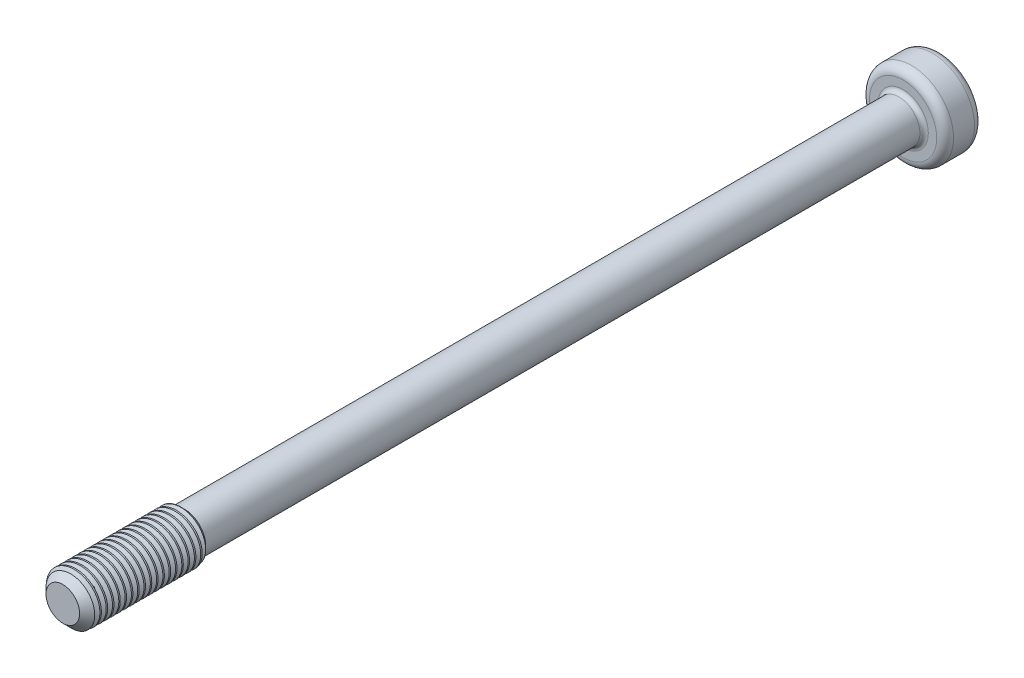
from build123d import *

# Parameters (mm, degrees)
SKETCH1_R           = 1
BOSS_EXTRUDE1_DEPTH = 0.9
SKETCH2_R           = 0.5
BOSS_EXTRUDE2_DEPTH = 20
CUT_EXTRUDE5_DEPTH  = 0.15
CIRPATTERN2_COUNT   = 4
FILLET2_R           = 0.1
FILLET3_R           = 0.2
SKETCH10_R          = 0.6
BOSS_EXTRUDE3_DEPTH = 3
CHAMFER1_SIZE       = 0.2
CUT_SWEEP1_PITCH    = 0.15


with BuildPart() as part:
    # Sketch1 → Boss-Extrude1 (new body)
    with BuildSketch(Plane.XY):
        Circle(SKETCH1_R)
    extrude(amount=BOSS_EXTRUDE1_DEPTH)

    # Sketch2 → Boss-Extrude2 (add)
    with BuildSketch(Plane.XY.offset(0.9)):
        Circle(SKETCH2_R)
    extrude(amount=BOSS_EXTRUDE2_DEPTH)

    # Sketch4 → Cut-Extrude5 (cut, symmetric)
    with BuildSketch(Plane(origin=(0, 0, 0), x_dir=(1, 0, 0), z_dir=(0, 1, 0))):
        Polygon((-0.608938415, -0.8), (0, -0.8), (0, 0), (-0.75, 0), align=None)
    cut_extrude5 = extrude(amount=CUT_EXTRUDE5_DEPTH, both=True, mode=Mode.SUBTRACT)

    # CirPattern2: Cut-Extrude5 ×4 about axis
    cirpattern2_axis = Axis((0, 0, 0), (0, 0, 1))
    for i in range(1, CIRPATTERN2_COUNT):
        add(cut_extrude5.rotate(cirpattern2_axis, i * 360 / CIRPATTERN2_COUNT), mode=Mode.SUBTRACT)

    # Sketch7 → Cut-Revolve3 (revolve, cut)
    with BuildSketch(Plane(origin=(0, 0, 0), x_dir=(0, 0, 1), z_dir=(-0.7071067811865498, -0.7071067811865452, 0)), mode=Mode.PRIVATE) as cut_revolve3_sk:
        Polygon((0, 0.212132034), (0.8, 0.212132034), (0, 0.3), align=None)
        Polygon((0.9, 0), (0.8, 0.212132034), (0, 0.212132034), (0, 0), (0.8, 0), align=None)
    revolve(cut_revolve3_sk.sketch.rotate(Axis((0, 0, 23.484013407), (0, 0, -1)), 315), axis=Axis((0, 0, 23.484013407), (0, 0, -1)), mode=Mode.SUBTRACT)

    # Fillet2
    fillet2_edges = [part.edges().sort_by_distance(p)[0] for p in [
        (-0.5, 0, 0.9),
    ]]
    fillet(fillet2_edges, radius=FILLET2_R)

    # Fillet3
    fillet3_edges = [part.edges().sort_by_distance(p)[0] for p in [
        (-1, 0, 0),
        (-1, 0, 0.9),
    ]]
    fillet(fillet3_edges, radius=FILLET3_R)

    # Sketch10 → Boss-Extrude3 (add)
    with BuildSketch(Plane.XY.offset(20.9)):
        Circle(SKETCH10_R)
    extrude(amount=-BOSS_EXTRUDE3_DEPTH)

    # Chamfer1
    # the kernel refuses this chamfer: 0.2 mm, written as the material it takes off along each edge
    with BuildSketch(Plane(origin=(0, 0, 17.9), x_dir=(1, 0, 0), z_dir=(0, -1, 0))) as chamfer1_piece_1_section:
        Polygon((0.6 - CHAMFER1_SIZE, 0), (0.6, CHAMFER1_SIZE), (0.6, 0), align=None)
    chamfer1_piece_1 = revolve(axis=Axis((0, 0, 17.9), (0, 0, 1)), mode=Mode.PRIVATE)
    chamfer1_piece_1 = chamfer1_piece_1 - Plane(origin=(0, 0, 18.050100848), x_dir=(1, 0, 0), z_dir=(0, 0, -1)) * Cylinder(0.5, 3, mode=Mode.PRIVATE)
    add(chamfer1_piece_1, mode=Mode.SUBTRACT)
    with BuildSketch(Plane(origin=(0, 0, 20.9), x_dir=(1, 0, 0), z_dir=(0, -1, 0))) as chamfer1_piece_2:
        Polygon((0.6, -CHAMFER1_SIZE), (0.6 - CHAMFER1_SIZE, 0), (0.6, 0), align=None)
    revolve(axis=Axis((0, 0, 20.9), (0, 0, 1)), mode=Mode.SUBTRACT)

    # Cut-Sweep1: the profile of Sketch13 profile screwed along a right-hand helix of 22 turns, 6 arcs to a turn; built about Z, then put on its axis
    cut_sweep1_z = Axis((0, 0, 0), (0, 0, 1))
    cut_sweep1_corners = [(0.5, 0, 0), (0.6003, 0, 0.057908232), (0.6003, 0, -0.057908232)]
    with BuildLine(mode=Mode.PRIVATE) as cut_sweep1_profile:
        Line(cut_sweep1_corners[0], cut_sweep1_corners[1])
        Line(cut_sweep1_corners[1], cut_sweep1_corners[2])
        Line(cut_sweep1_corners[2], cut_sweep1_corners[0])
    cut_sweep1_cap = Face(cut_sweep1_profile.wire())
    cut_sweep1_turn_angles = [0, 30, 60, 90, 120, 150, 180, 210, 240, 270, 300, 330, 360]
    cut_sweep1_turn_weights = [1, 0.8660254037844387, 1, 0.8660254037844387, 1, 0.8660254037844387, 1, 0.8660254037844387, 1, 0.8660254037844387, 1, 0.8660254037844387, 1]
    cut_sweep1_turn_rails = [Edge.make_bspline([Vector(p[0], p[1], 0).rotate(cut_sweep1_z, cut_sweep1_turn_angles[k]) / cut_sweep1_turn_weights[k] + Vector(0, 0, p[2] + CUT_SWEEP1_PITCH * cut_sweep1_turn_angles[k] / 360) for k in range(13)], [0, 0, 0, 1, 1, 2, 2, 3, 3, 4, 4, 5, 5, 6, 6, 6], 2, cut_sweep1_turn_weights) for p in cut_sweep1_corners]
    cut_sweep1_turn_sides = [Face.make_surface_from_curves(cut_sweep1_turn_rails[p[0]], cut_sweep1_turn_rails[p[1]]) for p in [(0, 1), (1, 2), (2, 0)]]
    cut_sweep1 = Plane(origin=(0, 0, 20.9), x_dir=(-1, 0, 0), z_dir=(0, 0, -1)) * Solid(Shell([*[p.moved(Location((0, 0, CUT_SWEEP1_PITCH * i))) for i in range(22) for p in cut_sweep1_turn_sides], cut_sweep1_cap, cut_sweep1_cap.rotate(cut_sweep1_z, 7920).moved(Location((0, 0, CUT_SWEEP1_PITCH * 7920 / 360)))]))
    add(cut_sweep1, mode=Mode.SUBTRACT)


solid = part.part
